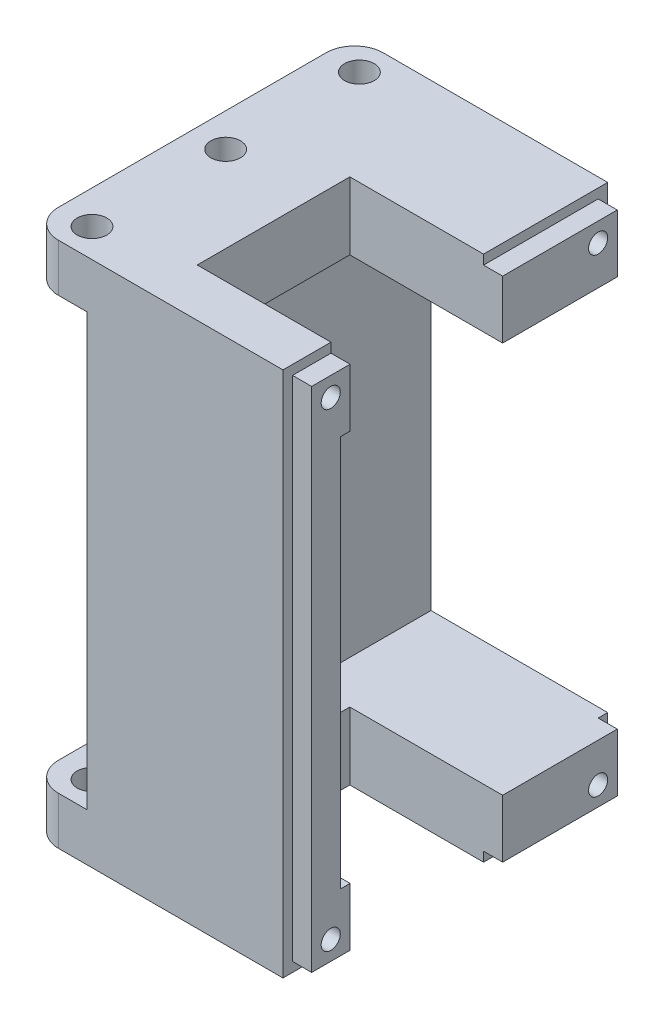
from build123d import *

# Parameters (mm, degrees)
SKETCH_1_W           = 20.5
SKETCH_1_H           = 15.141704846
SKETCH_1_R           = 2
EXTRUDE_1_DEPTH      = 29
EXTRUDE_1_2_DEPTH    = 29
SKETCH_2_W           = 20.5
SKETCH_2_H           = 70.283409692
EXTRUDE_2_DEPTH      = 3
SKETCH_3_W           = 20.5
SKETCH_3_H           = 7.570852423
CUT_EXTRUDE_1_DEPTH  = 49.621002864
EXTRUDE_3_DEPTH      = 10
CUT_EXTRUDE_2_REACH  = 75.297
SKETCH_8_R           = 1.6
SKETCH_9_W           = 20.5
SKETCH_9_H           = 32
CUT_EXTRUDE_3_DEPTH  = 65.572982844
SKETCH_12_W          = 20.5
SKETCH_12_H          = 7.570852423
SKETCH_12_R          = 2
EXTRUDE_5_DEPTH      = 30
SKETCH_13_R          = 4
SKETCH_13_R_2        = 2.5
EXTRUDE_6_DEPTH      = 10
CUT_EXTRUDE_5_DEPTH  = 48.388093988
CUT_EXTRUDE_6_DEPTH  = 51.404676959
EXTRUDE_START        = 10
EXTRUDE_7_DEPTH      = 10
CUT_EXTRUDE_7_DEPTH  = 48.388094067
CUT_EXTRUDE_8_DEPTH  = 51.404676959
SKETCH_23_W          = 20.5
SKETCH_23_H          = 55.141704846
EXTRUDE_8_DEPTH      = 2
SKETCH_24_W          = 10
SKETCH_24_H          = 55.141704846
EXTRUDE_9_DEPTH      = 2
SKETCH_25_W          = 8
SKETCH_25_H          = 7.570852423
CUT_EXTRUDE_9_DEPTH  = 16
EXTRUDE_START_2      = 20
SKETCH_26_R          = 2
EXTRUDE_10_DEPTH     = 20
SKETCH_27_W          = 16
SKETCH_27_H          = 8
CUT_EXTRUDE_10_DEPTH = 75.494994619
SKETCH_29_W          = 34
SKETCH_29_H          = 55.141704846
SKETCH_29_W_2        = 32
SKETCH_29_H_2        = 53.141704846
CUT_EXTRUDE_11_DEPTH = 2
SKETCH_32_W          = 15.976862795
SKETCH_32_H          = 55.18580585
CUT_EXTRUDE_13_DEPTH = 16
SKETCH_33_R          = 1
CUT_EXTRUDE_14_DEPTH = 16
SKETCH_35_R          = 1
CUT_EXTRUDE_15_DEPTH = 5
SKETCH_36_R          = 2.65
CUT_EXTRUDE_16_DEPTH = 10
CUT_EXTRUDE_START    = -10
SKETCH_37_R          = 2.65
CUT_EXTRUDE_17_DEPTH = 10
SKETCH_38_W          = 37
SKETCH_38_H          = 68
CUT_EXTRUDE_18_DEPTH = 10
SKETCH_39_W          = 24
SKETCH_39_H          = 55.141704846
EXTRUDE_11_DEPTH     = 2
SKETCH_40_W          = 20.5
SKETCH_40_H          = 34
CUT_EXTRUDE_19_DEPTH = 66.929281153
SKETCH_41_W          = 5
SKETCH_41_H          = 34
EXTRUDE_12_DEPTH     = 5
SKETCH_42_R          = 2
CUT_EXTRUDE_20_DEPTH = 68.038571833
SKETCH_43_W          = 1
SKETCH_43_H          = 34
EXTRUDE_13_DEPTH     = 5
SKETCH_44_W          = 34
SKETCH_44_H          = 5
EXTRUDE_14_DEPTH     = 1
EXTRUDE_START_3      = -5
SKETCH_45_R          = 2
SKETCH_45_R_2        = 1.55
EXTRUDE_15_DEPTH     = 5
SKETCH_46_R          = 2
SKETCH_46_R_2        = 1.55
EXTRUDE_16_DEPTH     = 5
FILLET_1_R           = 3
FILLET_2_R           = 3
FILLET_3_R           = 3
FILLET_4_R           = 3
SKETCH_47_R          = 2
EXTRUDE_17_DEPTH     = 10
SKETCH_48_R          = 2
CUT_EXTRUDE_21_DEPTH = 10
SKETCH_49_W          = 20.5
SKETCH_49_H          = 41
CUT_EXTRUDE_23_DEPTH = 30


with BuildPart() as part:
    # 草图1 → 凸台-拉伸1 (new body)
    with BuildSketch(Plane.XY):
        with Locations((0, -27.570852423)):
            Rectangle(SKETCH_1_W, SKETCH_1_H)
        with Locations((-5, -25)):
            Circle(SKETCH_1_R, mode=Mode.SUBTRACT)
        with Locations((5, -25)):
            Circle(SKETCH_1_R, mode=Mode.SUBTRACT)
    extrude(amount=EXTRUDE_1_DEPTH)



with BuildPart() as body_2:
    # 草图1 → Extrude 1 2 (new body)
    with BuildSketch(Plane.XY):
        with Locations((0, 27.570852423)):
            Rectangle(SKETCH_1_W, SKETCH_1_H)
        with Locations((5, 25)):
            Circle(SKETCH_1_R, mode=Mode.SUBTRACT)
        with Locations((-5, 25)):
            Circle(SKETCH_1_R, mode=Mode.SUBTRACT)
    extrude(amount=EXTRUDE_1_2_DEPTH)


with BuildPart() as part_1:
    add(part.part)

    add(body_2.part)  # 凸台-拉伸2 merges body 2
    # 草图2 → 凸台-拉伸2 (add)
    with BuildSketch(Plane.XY.offset(29)):
        Rectangle(SKETCH_2_W, SKETCH_2_H)
    extrude(amount=EXTRUDE_2_DEPTH)

    # 草图3 → 切除-拉伸1 (cut, through all)
    with BuildSketch(Plane(origin=(0, 0, 0), x_dir=(-1, 0, 0), z_dir=(0, 0, -1))):
        with Locations((0, -31.356278635)):
            Rectangle(SKETCH_3_W, SKETCH_3_H)
        with Locations((0, 31.356278635)):
            Rectangle(SKETCH_3_W, SKETCH_3_H)
    extrude(amount=-CUT_EXTRUDE_1_DEPTH, mode=Mode.SUBTRACT)

    # 草图5 → 凸台-拉伸3 (add)
    with BuildSketch(Plane.XZ.offset(27.570852423)):
        with BuildLine():
            ThreePointArc((0, 0), (1.767766953, 0.732233047), (2.5, 2.5))
            ThreePointArc((2.5, 2.5), (-1.767766953, 4.267766953), (0, 0))
        make_face()
    extrude(amount=EXTRUDE_3_DEPTH)

    # 草图8 → 切除-拉伸2 (cut, up to next)
    with BuildSketch(Plane(origin=(0, 27.570852423, 0), x_dir=(1, 0, 0), z_dir=(0, 1, 0)), mode=Mode.PRIVATE) as cut_extrude_2_sk1:
        with Locations((0, -16.5)):
            Circle(SKETCH_8_R)
    cut_extrude_2_tool1 = extrude(cut_extrude_2_sk1.sketch, amount=-CUT_EXTRUDE_2_REACH, mode=Mode.PRIVATE) & part_1.part
    # 草图8 → 切除-拉伸2 (cut, up to next)
    with BuildSketch(Plane(origin=(0, 27.570852423, 0), x_dir=(1, 0, 0), z_dir=(0, 1, 0)), mode=Mode.PRIVATE) as cut_extrude_2_sk2:
        with Locations((0, -26.5)):
            Circle(SKETCH_8_R)
    cut_extrude_2_tool2 = extrude(cut_extrude_2_sk2.sketch, amount=-CUT_EXTRUDE_2_REACH, mode=Mode.PRIVATE) & part_1.part
    add(cut_extrude_2_tool1.solids().sort_by_distance((0, 27.570852, 16.5))[0], mode=Mode.SUBTRACT)
    add(cut_extrude_2_tool2.solids().sort_by_distance((0, 27.570852, 26.5))[0], mode=Mode.SUBTRACT)

    # 草图9 → 切除-拉伸3 (cut, through all)
    with BuildSketch(Plane.XZ.offset(27.570852423)):
        with Locations((0, 16)):
            Rectangle(SKETCH_9_W, SKETCH_9_H)
    extrude(amount=CUT_EXTRUDE_3_DEPTH, mode=Mode.SUBTRACT)

    # 草图12 → 凸台-拉伸5 (add)
    with BuildSketch(Plane(origin=(0, 0, 0), x_dir=(-1, 0, 0), z_dir=(0, 0, -1))):
        with Locations((0, 23.785426212)):
            Rectangle(SKETCH_12_W, SKETCH_12_H)
        with Locations((-5, 25)):
            Circle(SKETCH_12_R, mode=Mode.SUBTRACT)
        with Locations((5, 25)):
            Circle(SKETCH_12_R, mode=Mode.SUBTRACT)
    extrude(amount=-EXTRUDE_5_DEPTH)

    # 草图13 → 凸台-拉伸6 (add)
    with BuildSketch(Plane(origin=(0, 27.570852423, 0), x_dir=(1, 0, 0), z_dir=(0, 1, 0))):
        with Locations((0, -5)):
            Circle(SKETCH_13_R)
        with Locations((0, -5)):
            Circle(SKETCH_13_R_2, mode=Mode.SUBTRACT)
    extrude(amount=EXTRUDE_6_DEPTH)

    # 草图15 → 旋转1 (revolve)
    with BuildSketch(Plane(origin=(0, 0, 0), x_dir=(0, 0, -1), z_dir=(1, 0, 0))):
        with BuildLine():
            Line((-1, 27.570852423), (0, 27.570852423))
            ThreePointArc((0, 27.570852423), (-0.712891912, 27.930797461), (-1, 28.676011695))
            Line((-1, 28.676011695), (-1, 27.570852423))
        make_face()
    revolve(axis=Axis((0, -962.429147577, 5), (0, 1, 0)))

    # 草图16 → 切除-拉伸5 (cut, through all)
    with BuildSketch(Plane.XY.offset(5)):
        with BuildLine():
            ThreePointArc((0, 35.070852423), (-1.060660172, 32.510192251), (1.5, 33.570852423))
            ThreePointArc((1.5, 33.570852423), (1.060660172, 34.631512595), (0, 35.070852423))
        make_face()
    extrude(amount=-CUT_EXTRUDE_5_DEPTH, mode=Mode.SUBTRACT)

    # 草图17 → 切除-拉伸6 (cut, through all)
    with BuildSketch(Plane(origin=(0, 0, 0), x_dir=(0, 0, -1), z_dir=(1, 0, 0))):
        with BuildLine():
            ThreePointArc((-5, 35.070852423), (-6.060660172, 32.510192251), (-3.5, 33.570852423))
            ThreePointArc((-3.5, 33.570852423), (-3.939339828, 34.631512595), (-5, 35.070852423))
        make_face()
    extrude(amount=-CUT_EXTRUDE_6_DEPTH, mode=Mode.SUBTRACT)

    # 草图19 → 凸台-拉伸7 (add)
    with BuildSketch(Plane.XZ.offset(27.570852423).offset(EXTRUDE_START)):
        with BuildLine():
            ThreePointArc((4, 5), (-2.828427125, 7.828427125), (0, 1))
            ThreePointArc((0, 1), (2.828427125, 2.171572875), (4, 5))
        make_face()
        with BuildLine():
            ThreePointArc((2.5, 5), (1.767766953, 3.232233047), (0, 2.5))
            ThreePointArc((0, 2.5), (-1.767766953, 6.767766953), (2.5, 5))
        make_face(mode=Mode.SUBTRACT)
    extrude(amount=-EXTRUDE_7_DEPTH)

    # 草图20 → 旋转2 (revolve)
    with BuildSketch(Plane(origin=(0, 0, 0), x_dir=(0, 0, -1), z_dir=(1, 0, 0))):
        with BuildLine():
            Line((-1, -27.570852423), (0, -27.570852423))
            ThreePointArc((0, -27.570852423), (-0.707106781, -27.863745642), (-1, -28.570852423))
            Line((-1, -28.570852423), (-1, -27.570852423))
        make_face()
    revolve(axis=Axis((0, -1027.570852423, 5), (0, 1, 0)))

    # 草图21 → 切除-拉伸7 (cut, through all)
    with BuildSketch(Plane.XY.offset(5)):
        with BuildLine():
            ThreePointArc((0, -35.070852423), (1.060660172, -34.631512595), (1.5, -33.570852423))
            ThreePointArc((1.5, -33.570852423), (-1.060660172, -32.510192251), (0, -35.070852423))
        make_face()
    extrude(amount=-CUT_EXTRUDE_7_DEPTH, mode=Mode.SUBTRACT)

    # 草图22 → 切除-拉伸8 (cut, through all)
    with BuildSketch(Plane(origin=(0, 0, 0), x_dir=(0, 0, -1), z_dir=(1, 0, 0))):
        with BuildLine():
            ThreePointArc((-5, -35.070852423), (-3.939339828, -34.631512595), (-3.5, -33.570852423))
            ThreePointArc((-3.5, -33.570852423), (-6.060660172, -32.510192251), (-5, -35.070852423))
        make_face()
    extrude(amount=-CUT_EXTRUDE_8_DEPTH, mode=Mode.SUBTRACT)

    # 草图23 → 凸台-拉伸8 (add)
    with BuildSketch(Plane.XY.offset(32)):
        Rectangle(SKETCH_23_W, SKETCH_23_H)
    extrude(amount=EXTRUDE_8_DEPTH)

    # 草图24 → 凸台-拉伸9 (add)
    with BuildSketch(Plane.ZY.offset(10.25)):
        with Locations((29, 0)):
            Rectangle(SKETCH_24_W, SKETCH_24_H)
    extrude(amount=EXTRUDE_9_DEPTH)

    # 草图25 → 切除-拉伸9 (cut)
    with BuildSketch(Plane(origin=(10.25, 0, 0), x_dir=(0, 0, -1), z_dir=(1, 0, 0))):
        with Locations((-21, 23.785426212)):
            Rectangle(SKETCH_25_W, SKETCH_25_H)
        with Locations((-21, -23.785426212)):
            Rectangle(SKETCH_25_W, SKETCH_25_H)
    extrude(amount=-CUT_EXTRUDE_9_DEPTH, mode=Mode.SUBTRACT)

    # 草图26 → 凸台-拉伸10 (add)
    with BuildSketch(Plane(origin=(0, 0, 29), x_dir=(-1, 0, 0), z_dir=(0, 0, -1)).offset(EXTRUDE_START_2)):
        with Locations((-5, 25)):
            Circle(SKETCH_26_R)
        with Locations((5, 25)):
            Circle(SKETCH_26_R)
        with Locations((-5, -25)):
            Circle(SKETCH_26_R)
        with Locations((5, -25)):
            Circle(SKETCH_26_R)
    extrude(amount=-EXTRUDE_10_DEPTH)

    # 草图27 → 切除-拉伸10 (cut, through all)
    with BuildSketch(Plane.XZ.offset(27.570852423)):
        with Locations((2.25, 21)):
            Rectangle(SKETCH_27_W, SKETCH_27_H)
    extrude(amount=-CUT_EXTRUDE_10_DEPTH, mode=Mode.SUBTRACT)

    # 草图29 → 切除-拉伸11 (cut)
    with BuildSketch(Plane(origin=(10.25, 0, 0), x_dir=(0, 0, -1), z_dir=(1, 0, 0))):
        with Locations((-17, 0)):
            Rectangle(SKETCH_29_W, SKETCH_29_H)
        with Locations((-17, 0)):
            Rectangle(SKETCH_29_W_2, SKETCH_29_H_2, mode=Mode.SUBTRACT)
    extrude(amount=-CUT_EXTRUDE_11_DEPTH, mode=Mode.SUBTRACT)

    # 草图32 → 切除-拉伸13 (cut)
    with BuildSketch(Plane(origin=(10.25, 0, 0), x_dir=(0, 0, -1), z_dir=(1, 0, 0))):
        with Locations((-20.988431398, 0.000987062)):
            Rectangle(SKETCH_32_W, SKETCH_32_H)
    extrude(amount=-CUT_EXTRUDE_13_DEPTH, mode=Mode.SUBTRACT)

    # 草图33 → 切除-拉伸14 (cut)
    with BuildSketch(Plane(origin=(10.25, 0, 0), x_dir=(0, 0, -1), z_dir=(1, 0, 0))):
        with Locations((-31, 24.570852423)):
            Circle(SKETCH_33_R)
        with Locations((-31, -24.570852423)):
            Circle(SKETCH_33_R)
    extrude(amount=-CUT_EXTRUDE_14_DEPTH, mode=Mode.SUBTRACT)

    # 草图35 → 切除-拉伸15 (cut)
    with BuildSketch(Plane(origin=(10.25, 0, 0), x_dir=(0, 0, -1), z_dir=(1, 0, 0))):
        with Locations((-3, 24.570852423)):
            Circle(SKETCH_35_R)
        with Locations((-3, -24.570852423)):
            Circle(SKETCH_35_R)
    extrude(amount=-CUT_EXTRUDE_15_DEPTH, mode=Mode.SUBTRACT)

    # 草图36 → 切除-拉伸16 (cut)
    with BuildSketch(Plane.XZ.offset(37.570852423)):
        with Locations((0, 5)):
            Circle(SKETCH_36_R)
    extrude(amount=-CUT_EXTRUDE_16_DEPTH, mode=Mode.SUBTRACT)

    # 草图37 → 切除-拉伸17 (cut)
    with BuildSketch(Plane(origin=(0, 37.570852423, 0), x_dir=(1, 0, 0), z_dir=(0, 1, 0)).offset(CUT_EXTRUDE_START)):
        with Locations((0, -5)):
            Circle(SKETCH_37_R)
    extrude(amount=CUT_EXTRUDE_17_DEPTH, mode=Mode.SUBTRACT)

    # 草图38 → 切除-拉伸18 (cut)
    with BuildSketch(Plane.XZ.offset(27.570852423)):
        with Locations((-10.25, 0)):
            Rectangle(SKETCH_38_W, SKETCH_38_H)
    extrude(amount=CUT_EXTRUDE_18_DEPTH, mode=Mode.SUBTRACT)

    # 草图39 → 凸台-拉伸11 (add)
    with BuildSketch(Plane.ZY.offset(10.25)):
        with Locations((12, 0)):
            Rectangle(SKETCH_39_W, SKETCH_39_H)
    extrude(amount=EXTRUDE_11_DEPTH)

    # 草图40 → 切除-拉伸19 (cut, through all)
    with BuildSketch(Plane(origin=(0, 27.570852423, 0), x_dir=(1, 0, 0), z_dir=(0, 1, 0))):
        with Locations((-2, -17)):
            Rectangle(SKETCH_40_W, SKETCH_40_H)
    extrude(amount=CUT_EXTRUDE_19_DEPTH, mode=Mode.SUBTRACT)

    # 草图41 → 凸台-拉伸12 (add)
    with BuildSketch(Plane(origin=(0, 27.570852423, 0), x_dir=(1, 0, 0), z_dir=(0, 1, 0))):
        with Locations((-14.75, -17)):
            Rectangle(SKETCH_41_W, SKETCH_41_H)
    extrude_12 = extrude(amount=-EXTRUDE_12_DEPTH)

    # 镜向1: 凸台-拉伸12 across plane
    add(extrude_12.mirror(Plane.ZX))

    # 草图42 → 切除-拉伸20 (cut, through all)
    with BuildSketch(Plane.XZ.offset(27.570852423)):
        with Locations((-14.75, 3)):
            Circle(SKETCH_42_R)
        with Locations((-14.75, 31)):
            Circle(SKETCH_42_R)
        with Locations((-14.75, 17)):
            Circle(SKETCH_42_R)
    extrude(amount=-CUT_EXTRUDE_20_DEPTH, mode=Mode.SUBTRACT)

    # 草图43 → 凸台-拉伸13 (add)
    with BuildSketch(Plane.XZ.offset(27.570852423)):
        with Locations((-17.75, 17)):
            Rectangle(SKETCH_43_W, SKETCH_43_H)
    extrude(amount=-EXTRUDE_13_DEPTH)

    # 草图44 → 凸台-拉伸14 (add)
    with BuildSketch(Plane.ZY.offset(17.25)):
        with Locations((17, 25.070852423)):
            Rectangle(SKETCH_44_W, SKETCH_44_H)
    extrude(amount=EXTRUDE_14_DEPTH)

    # 草图45 → 凸台-拉伸15 (add)
    # profile 1 of 3: a face of its own
    with BuildSketch(Plane(origin=(0, 27.570852423, 0), x_dir=(1, 0, 0), z_dir=(0, 1, 0)).offset(EXTRUDE_START_3)):
        with Locations((-14.75, -3)):
            Circle(SKETCH_45_R)
        with Locations((-14.75, -3)):
            Circle(SKETCH_45_R_2, mode=Mode.SUBTRACT)
    # profile 2 of 3: a face of its own
    with BuildSketch(Plane(origin=(0, 27.570852423, 0), x_dir=(1, 0, 0), z_dir=(0, 1, 0)).offset(EXTRUDE_START_3)):
        with Locations((-14.75, -17)):
            Circle(SKETCH_45_R)
        with Locations((-14.75, -17)):
            Circle(SKETCH_45_R_2, mode=Mode.SUBTRACT)
    # profile 3 of 3: a face of its own
    with BuildSketch(Plane(origin=(0, 27.570852423, 0), x_dir=(1, 0, 0), z_dir=(0, 1, 0)).offset(EXTRUDE_START_3)):
        with Locations((-14.75, -31)):
            Circle(SKETCH_45_R)
        with Locations((-14.75, -31)):
            Circle(SKETCH_45_R_2, mode=Mode.SUBTRACT)
    extrude(amount=EXTRUDE_15_DEPTH)

    # 草图46 → 凸台-拉伸16 (add)
    # profile 1 of 3: a face of its own
    with BuildSketch(Plane.XZ.offset(27.570852423)):
        with Locations((-14.75, 31)):
            Circle(SKETCH_46_R)
        with Locations((-14.75, 31)):
            Circle(SKETCH_46_R_2, mode=Mode.SUBTRACT)
    # profile 2 of 3: a face of its own
    with BuildSketch(Plane.XZ.offset(27.570852423)):
        with Locations((-14.75, 17)):
            Circle(SKETCH_46_R)
        with Locations((-14.75, 17)):
            Circle(SKETCH_46_R_2, mode=Mode.SUBTRACT)
    # profile 3 of 3: a face of its own
    with BuildSketch(Plane.XZ.offset(27.570852423)):
        with Locations((-14.75, 3)):
            Circle(SKETCH_46_R)
        with Locations((-14.75, 3)):
            Circle(SKETCH_46_R_2, mode=Mode.SUBTRACT)
    extrude(amount=-EXTRUDE_16_DEPTH)

    # 圆角1
    fillet_1_edges = [part_1.edges().sort_by_distance(p)[0] for p in [
        (-18.25, -25.070852423, 0),
    ]]
    fillet(fillet_1_edges, radius=FILLET_1_R)

    # 圆角2
    fillet_2_edges = [part_1.edges().sort_by_distance(p)[0] for p in [
        (-18.25, -25.070852423, 34),
    ]]
    fillet(fillet_2_edges, radius=FILLET_2_R)

    # 圆角3
    fillet_3_edges = [part_1.edges().sort_by_distance(p)[0] for p in [
        (-18.25, 25.070852423, 0),
    ]]
    fillet(fillet_3_edges, radius=FILLET_3_R)

    # 圆角4
    fillet_4_edges = [part_1.edges().sort_by_distance(p)[0] for p in [
        (-18.25, 25.070852423, 34),
    ]]
    fillet(fillet_4_edges, radius=FILLET_4_R)

    # 草图47 → 凸台-拉伸17 (add)
    with BuildSketch(Plane(origin=(0, 0, 0), x_dir=(-1, 0, 0), z_dir=(0, 0, -1))):
        with Locations((-5, 25)):
            Circle(SKETCH_47_R)
        with Locations((5, 25)):
            Circle(SKETCH_47_R)
        with Locations((-5, -25)):
            Circle(SKETCH_47_R)
        with Locations((5, -25)):
            Circle(SKETCH_47_R)
    extrude(amount=-EXTRUDE_17_DEPTH)

    # 草图48 → 切除-拉伸21 (cut)
    with BuildSketch(Plane(origin=(0, 0, 0), x_dir=(-1, 0, 0), z_dir=(0, 0, -1))):
        with Locations((-5, 24.5)):
            Circle(SKETCH_48_R)
        with Locations((5, 24.5)):
            Circle(SKETCH_48_R)
        with Locations((5, -24.5)):
            Circle(SKETCH_48_R)
        with Locations((-5, -24.5)):
            Circle(SKETCH_48_R)
    extrude(amount=-CUT_EXTRUDE_21_DEPTH, mode=Mode.SUBTRACT)

    # 草图49 → 切除-拉伸23 (cut)
    with BuildSketch(Plane(origin=(0, 0, 0), x_dir=(-1, 0, 0), z_dir=(0, 0, -1))):
        Rectangle(SKETCH_49_W, SKETCH_49_H)
    extrude(amount=-CUT_EXTRUDE_23_DEPTH, mode=Mode.SUBTRACT)


solid = part_1.part
